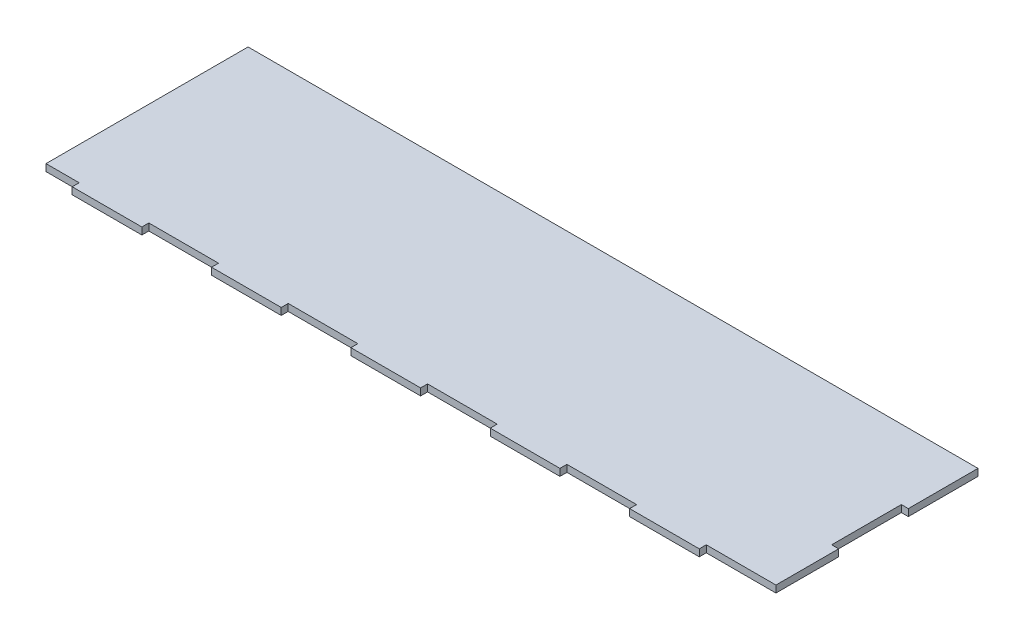
from build123d import *

# Parameters (mm, degrees)
SKETCH1_W              = 630
SKETCH1_H              = 90
BOSS_EXTRUDE1_DEPTH    = 3
SKETCH3_W              = 30
SKETCH3_H              = 3
CUT_EXTRUDE1_DEPTH     = 3
LPATTERN1_COUNT        = 10
LPATTERN1_PITCH        = 60
LPATTERN1_COL_COUNT    = 2
LPATTERN1_COL_PITCH    = 60
CUT_EXTRUDE5_START     = -3
CUT_EXTRUDE5_OUTLINE_W = 3
CUT_EXTRUDE5_OUTLINE_H = 30
CUT_EXTRUDE5_DEPTH     = 3
SKETCH7_W              = 3
SKETCH7_H              = 30
CUT_EXTRUDE3_DEPTH     = 3
SKETCH13_W             = 3
SKETCH13_H             = 27
CUT_EXTRUDE4_DEPTH     = 10


# Read off the part's stored shape, not the designer's step: Cut-Extrude5
with BuildPart() as part:
    # Sketch1 → Boss-Extrude1 (new body)
    with BuildSketch(Plane(origin=(0, 0, 0), x_dir=(1, 0, 0), z_dir=(0, 1, 0))):
        Rectangle(SKETCH1_W, SKETCH1_H)
    extrude(amount=BOSS_EXTRUDE1_DEPTH)

    # Sketch3 → Cut-Extrude1 (cut)
    with BuildSketch(Plane(origin=(0, 3, 0), x_dir=(1, 0, 0), z_dir=(0, 1, 0))):
        with Locations((-240, -43.5)):
            Rectangle(SKETCH3_W, SKETCH3_H)
    cut_extrude1 = extrude(amount=-CUT_EXTRUDE1_DEPTH, mode=Mode.SUBTRACT)

    # LPattern1: Cut-Extrude1 ×10
    with Locations(*[(i * LPATTERN1_PITCH, 0, 0) for i in range(1, LPATTERN1_COUNT)]):
        add(cut_extrude1, mode=Mode.SUBTRACT)

    # LPattern1 col: Cut-Extrude1 ×2
    with Locations(*[(-i * LPATTERN1_COL_PITCH, 0, 0) for i in range(1, LPATTERN1_COL_COUNT)]):
        add(cut_extrude1, mode=Mode.SUBTRACT)

    # Cut-Extrude5 outline → Cut-Extrude5 (cut)
    with BuildSketch(Plane(origin=(0, 3, 0), x_dir=(1, 0, 0), z_dir=(0, 1, 0)).offset(CUT_EXTRUDE5_START)):
        with Locations((313.5, 1e-09)):
            Rectangle(CUT_EXTRUDE5_OUTLINE_W, CUT_EXTRUDE5_OUTLINE_H)
    extrude(amount=CUT_EXTRUDE5_DEPTH, mode=Mode.SUBTRACT)

    # Sketch7 → Cut-Extrude3 (cut)
    with BuildSketch(Plane(origin=(0, 3, 0), x_dir=(1, 0, 0), z_dir=(0, 1, 0))):
        with Locations((-313.5, 30)):
            Rectangle(SKETCH7_W, SKETCH7_H)
    extrude(amount=-CUT_EXTRUDE3_DEPTH, mode=Mode.SUBTRACT)

    # Sketch13 → Cut-Extrude4 (cut)
    with BuildSketch(Plane(origin=(0, 3, 0), x_dir=(1, 0, 0), z_dir=(0, 1, 0))):
        with Locations((-313.5, -28.5)):
            Rectangle(SKETCH13_W, SKETCH13_H)
    extrude(amount=-CUT_EXTRUDE4_DEPTH, mode=Mode.SUBTRACT)

    # SurfaceCut1
    split(bisect_by=Plane.ZY.offset(-0.725), keep=Keep.BOTTOM)


solid = part.part
